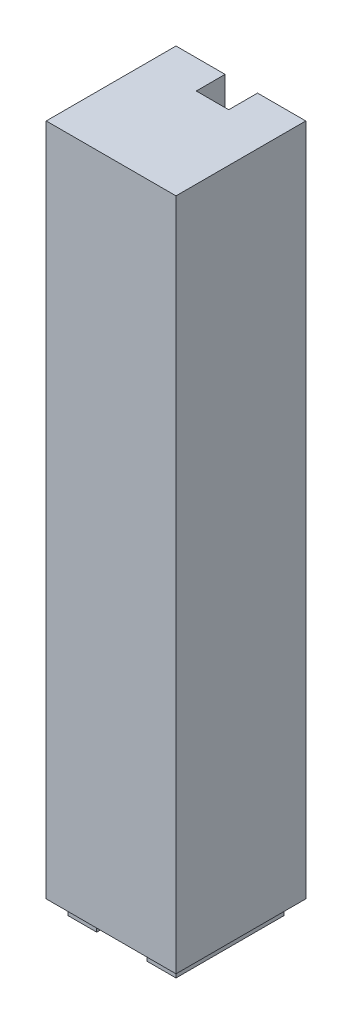
from build123d import *

# Parameters (mm, degrees)
SKETCH1_W           = 36
SKETCH1_H           = 36
BOSS_EXTRUDE1_DEPTH = 186.9
BOSS_EXTRUDE2_DEPTH = 4
SKETCH3_R           = 2
CUT_EXTRUDE1_DEPTH  = 5
SKETCH4_W           = 9
SKETCH4_H           = 186.9
CUT_EXTRUDE2_DEPTH  = 8


with BuildPart() as part:
    # Sketch1 → Boss-Extrude1 (new body)
    with BuildSketch(Plane(origin=(0, 0, 0), x_dir=(1, 0, 0), z_dir=(0, 1, 0))):
        with Locations((18, 18)):
            Rectangle(SKETCH1_W, SKETCH1_H)
    extrude(amount=BOSS_EXTRUDE1_DEPTH)

    # Sketch2 → Boss-Extrude2 (add)
    with BuildSketch(Plane.XZ):
        Polygon((3, -3), (7, -3), (11, -3), (11, -11), (7, -11), (7, -25), (11, -25), (11, -33), (7, -33), (3, -33), align=None)
        Polygon((29, -3), (33, -3), (33, -33), (29, -33), (25, -33), (25, -25), (29, -25), (29, -11), (25, -11), (25, -3), align=None)
    extrude(amount=BOSS_EXTRUDE2_DEPTH)

    # Sketch3 → Cut-Extrude1 (cut)
    with BuildSketch(Plane.XZ):
        with Locations((18, -18)):
            Circle(SKETCH3_R)
    extrude(amount=-CUT_EXTRUDE1_DEPTH, mode=Mode.SUBTRACT)

    # Sketch4 → Cut-Extrude2 (cut)
    with BuildSketch(Plane.XY.offset(-36)):
        with Locations((18.12, 93.45)):
            Rectangle(SKETCH4_W, SKETCH4_H)
    extrude(amount=CUT_EXTRUDE2_DEPTH, mode=Mode.SUBTRACT)


solid = part.part
